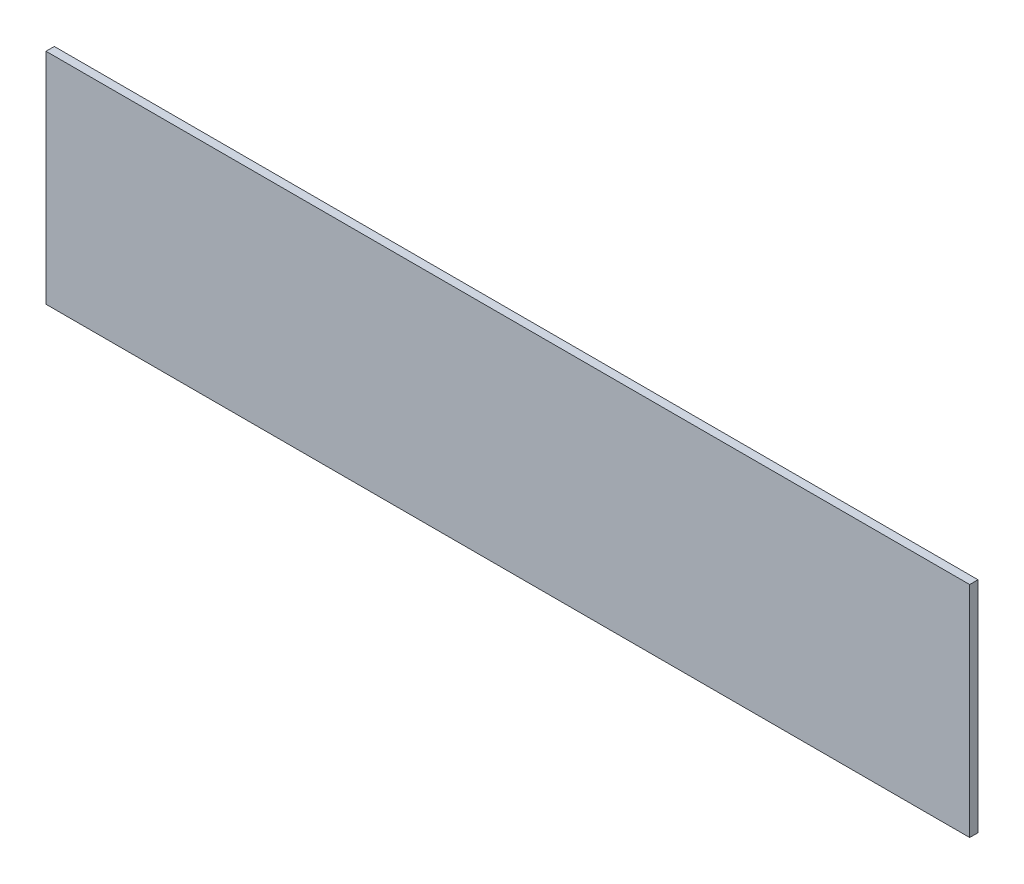
from build123d import *

# Parameters (mm, degrees)
SKETCH1_W           = 352.4
SKETCH1_H           = 83.6
BOSS_EXTRUDE1_DEPTH = 3.175


with BuildPart() as part:
    # Sketch1 → Boss-Extrude1 (new body)
    with BuildSketch(Plane.XY):
        Rectangle(SKETCH1_W, SKETCH1_H)
    extrude(amount=BOSS_EXTRUDE1_DEPTH)


solid = part.part
